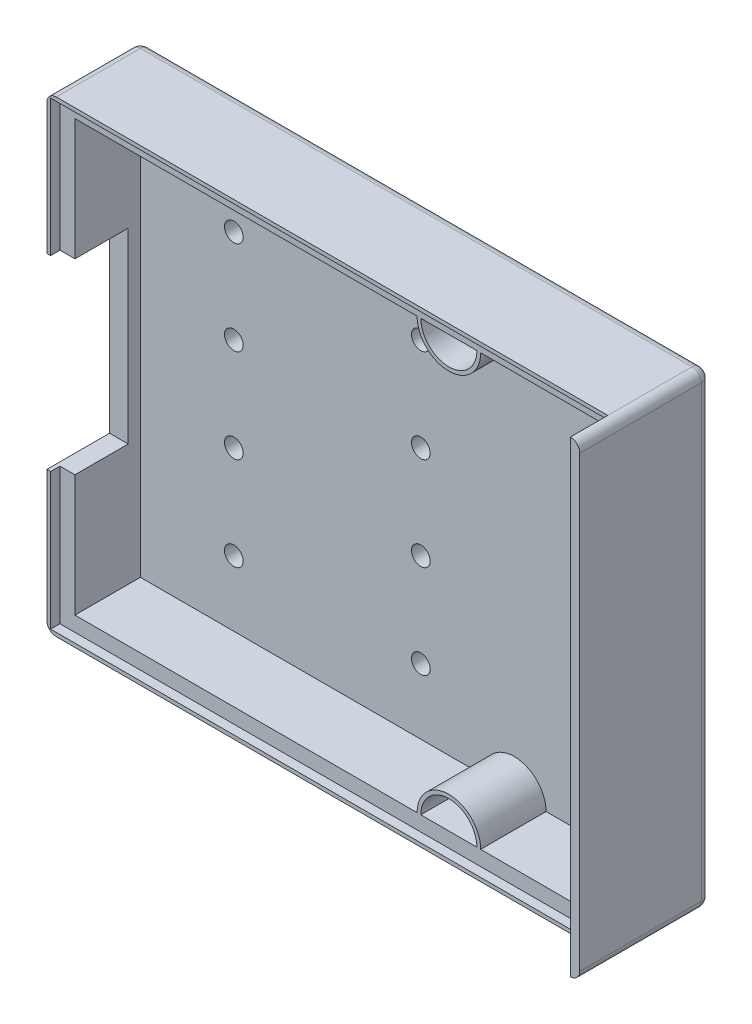
from build123d import *

# Parameters (mm, degrees)
ESQUISSE1_W             = 30
ESQUISSE1_H             = 25
BOSS_EXTRU_1_DEPTH      = 5
ESQUISSE2_W             = 28
ESQUISSE2_H             = 23
ENL_V_MAT_EXTRU_1_DEPTH = 4
ESQUISSE3_W             = 3.35
ESQUISSE3_H             = 10
ENL_V_MAT_EXTRU_2_DEPTH = 10
ESQUISSE4_W             = 4
ESQUISSE4_H             = 23
ENL_V_MAT_EXTRU_3_DEPTH = 10
BOSS_EXTRU_2_DEPTH      = 3.5
CONG_3_R                = 0.5
ENL_V_MAT_EXTRU_6_DEPTH = 0.5
ESQUISSE12_W            = 7
ESQUISSE12_H            = 25
BOSS_EXTRU_5_DEPTH      = 0.5
CONG_5_R                = 0.5
ESQUISSE13_R            = 0.5
ENL_V_MAT_EXTRU_8_DEPTH = 10.5


with BuildPart() as part:
    # Esquisse1 → Boss.-Extru.1 (new body)
    with BuildSketch(Plane.XY):
        with Locations((15, 12.5)):
            Rectangle(ESQUISSE1_W, ESQUISSE1_H)
    extrude(amount=BOSS_EXTRU_1_DEPTH)

    # Esquisse2 → Enlèv. mat.-Extru.1 (cut)
    with BuildSketch(Plane.XY.offset(5)):
        with Locations((15, 12.5)):
            Rectangle(ESQUISSE2_W, ESQUISSE2_H)
    extrude(amount=-ENL_V_MAT_EXTRU_1_DEPTH, mode=Mode.SUBTRACT)

    # Esquisse3 → Enlèv. mat.-Extru.2 (cut)
    with BuildSketch(Plane.ZY):
        with Locations((3.325, 12.5)):
            Rectangle(ESQUISSE3_W, ESQUISSE3_H)
    extrude(amount=-ENL_V_MAT_EXTRU_2_DEPTH, mode=Mode.SUBTRACT)

    # Esquisse4 → Enlèv. mat.-Extru.3 (cut)
    with BuildSketch(Plane(origin=(30, 0, 0), x_dir=(0, 0, -1), z_dir=(1, 0, 0))):
        with Locations((-3, 12.5)):
            Rectangle(ESQUISSE4_W, ESQUISSE4_H)
    extrude(amount=-ENL_V_MAT_EXTRU_3_DEPTH, mode=Mode.SUBTRACT)

    # Esquisse5 → Boss.-Extru.2 (add)
    # profile 1 of 2: a face of its own
    with BuildSketch(Plane.XY.offset(1)):
        with BuildLine():
            Line((19.311805698, 24.2), (22.688194302, 24.2))
            ThreePointArc((22.688194302, 24.2), (21, 22.3), (19.311805698, 24.2))
        make_face()
        with BuildLine():
            Line((19.5, 24), (22.5, 24))
            ThreePointArc((22.5, 24), (21, 22.5), (19.5, 24))
        make_face(mode=Mode.SUBTRACT)
    # profile 2 of 2: a face of its own
    with BuildSketch(Plane.XY.offset(1)):
        with BuildLine():
            Line((19.311805698, 0.8), (22.688194302, 0.8))
            ThreePointArc((22.688194302, 0.8), (21, 2.7), (19.311805698, 0.8))
        make_face()
        with BuildLine():
            Line((19.5, 1), (22.5, 1))
            ThreePointArc((22.5, 1), (21, 2.5), (19.5, 1))
        make_face(mode=Mode.SUBTRACT)
    extrude(amount=BOSS_EXTRU_2_DEPTH)

    # Congé3
    cong_3_edges = [part.edges().sort_by_distance(p)[0] for p in [
        (15, 25, 0),
        (15, 0, 0),
        (0, 12.5, 0),
        (0, 25, 2.5),
        (0, 0, 2.5),
    ]]
    fillet(cong_3_edges, radius=CONG_3_R)

    # Esquisse9 → Enlèv. mat.-Extru.6 (cut)
    with BuildSketch(Plane.XY.offset(5)):
        Polygon((0.2, 7.5), (0.2, 0.2), (30, 0.2), (30, 1), (1, 1), (1, 7.5), align=None)
        Polygon((1, 17.5), (0.2, 17.5), (0.2, 24.8), (30, 24.8), (30, 24), (1, 24), align=None)
    extrude(amount=-ENL_V_MAT_EXTRU_6_DEPTH, mode=Mode.SUBTRACT)

    # Esquisse12 → Boss.-Extru.5 (add)
    with BuildSketch(Plane(origin=(30, 0, 0), x_dir=(0, 0, -1), z_dir=(1, 0, 0))):
        with Locations((-3.5, 12.5)):
            Rectangle(ESQUISSE12_W, ESQUISSE12_H)
    extrude(amount=BOSS_EXTRU_5_DEPTH)

    # Congé5
    # the kernel refuses this fillet: 0.5 mm, written as the material it takes off along each edge
    with BuildSketch(Plane(origin=(30, 0.5, 0.5), x_dir=(0, 0, -1), z_dir=(0, -1, 0))) as cong_5_piece_1_section:
        Polygon((0, 0), (CONG_5_R * 1.02, 0), (CONG_5_R * 1.02, CONG_5_R * 1.02), (0, CONG_5_R * 1.02), align=None)
    cong_5_piece_1 = extrude(amount=CONG_5_R * 1.02, mode=Mode.PRIVATE)
    cong_5_piece_1 = cong_5_piece_1 - Plane(origin=(30, 0.5, 0.5), x_dir=(-0.7071067811865475, 0, 0.7071067811865475), z_dir=(0, -1, 0)) * Sphere(CONG_5_R, mode=Mode.PRIVATE)
    add(cong_5_piece_1, mode=Mode.SUBTRACT)
    with BuildSketch(Plane(origin=(30, 24.5, 0.5), x_dir=(1, 0, 0), z_dir=(0, 0, -1))) as cong_5_piece_2_section:
        Polygon((0, 0), (CONG_5_R * 1.02, 0), (CONG_5_R * 1.02, -CONG_5_R * 1.02), (0, -CONG_5_R * 1.02), align=None)
    cong_5_piece_2 = extrude(amount=CONG_5_R * 1.02, mode=Mode.PRIVATE)
    cong_5_piece_2 = cong_5_piece_2 - Plane(origin=(30, 24.5, 0.5), x_dir=(-0.7071067811865475, -0.7071067811865475, 0), z_dir=(0, 0, -1)) * Sphere(CONG_5_R, mode=Mode.PRIVATE)
    add(cong_5_piece_2, mode=Mode.SUBTRACT)
    with BuildSketch(Plane(origin=(30.5, 24.5, 0), x_dir=(-1, 0, 0), z_dir=(0, -1, 0))) as cong_5_piece_3:
        with BuildLine():
            CenterArc((CONG_5_R, -CONG_5_R), CONG_5_R, 90, 90)
            Line((0, -CONG_5_R), (0, 0))
            Line((0, 0), (CONG_5_R, 0))
        make_face()
    extrude(amount=24, mode=Mode.SUBTRACT)
    with BuildSketch(Plane(origin=(30.5, 25, 8.25), x_dir=(0, -1, 0), z_dir=(0, 0, -1))) as cong_5_piece_4:
        with BuildLine():
            CenterArc((CONG_5_R, CONG_5_R), CONG_5_R, 180, 90)
            Line((0, CONG_5_R), (0, 0))
            Line((0, 0), (CONG_5_R, 0))
        make_face()
    extrude(amount=7.75, mode=Mode.SUBTRACT)
    with BuildSketch(Plane(origin=(30.5, 0, 0.5), x_dir=(-1, 0, 0), z_dir=(0, 0, 1))) as cong_5_piece_5:
        with BuildLine():
            CenterArc((CONG_5_R, -CONG_5_R), CONG_5_R, 90, 90)
            Line((0, -CONG_5_R), (0, 0))
            Line((0, 0), (CONG_5_R, 0))
        make_face()
    extrude(amount=7.75, mode=Mode.SUBTRACT)

    # Esquisse13 → Enlèv. mat.-Extru.8 (cut)
    with BuildSketch(Plane(origin=(0, 0, 0), x_dir=(-1, 0, 0), z_dir=(0, 0, -1))):
        with Locations((-26, 19.5)):
            Circle(ESQUISSE13_R)
        with Locations((-16, 19.5)):
            Circle(ESQUISSE13_R)
        with Locations((-6, 19.5)):
            Circle(ESQUISSE13_R)
        with Locations((-16, 14.5)):
            Circle(ESQUISSE13_R)
        with Locations((-6, 14.5)):
            Circle(ESQUISSE13_R)
        with Locations((-16, 9.5)):
            Circle(ESQUISSE13_R)
        with Locations((-6, 9.5)):
            Circle(ESQUISSE13_R)
        with Locations((-16, 4.5)):
            Circle(ESQUISSE13_R)
        with Locations((-6, 4.5)):
            Circle(ESQUISSE13_R)
        with Locations((-26, 14.5)):
            Circle(ESQUISSE13_R)
        with Locations((-26, 9.5)):
            Circle(ESQUISSE13_R)
        with Locations((-26, 4.5)):
            Circle(ESQUISSE13_R)
    extrude(amount=-ENL_V_MAT_EXTRU_8_DEPTH, mode=Mode.SUBTRACT)


solid = part.part
